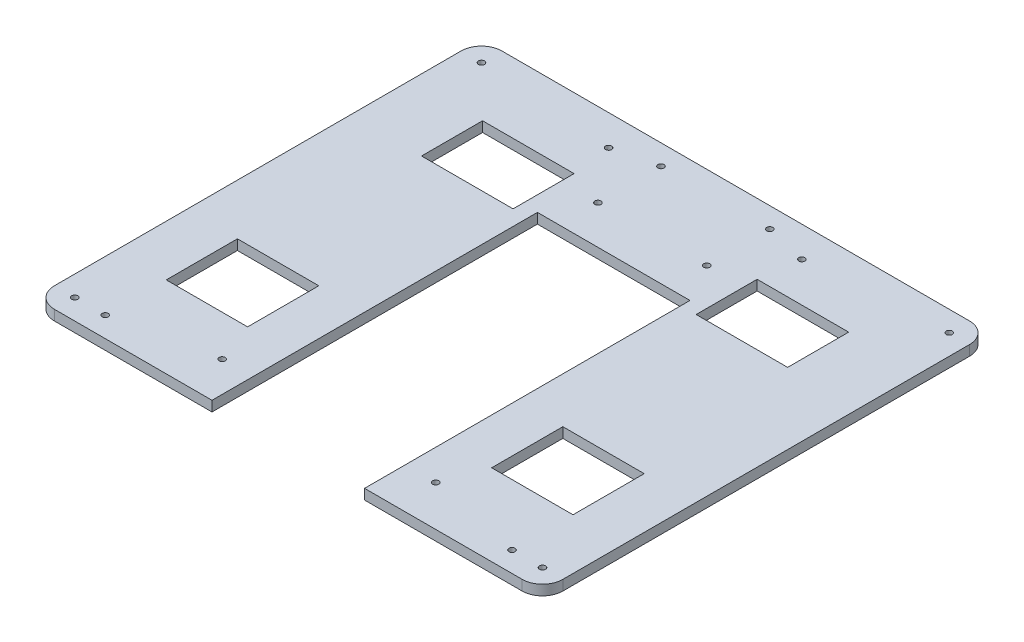
from build123d import *

# Parameters (mm, degrees)
EXTRUDE_1_DEPTH      = 5
SKETCH_4_W           = 45
SKETCH_4_H           = 30
CUT_EXTRUDE_3_DEPTH  = 5
SKETCH_5_W           = 75
SKETCH_5_H           = 160
CUT_EXTRUDE_4_DEPTH  = 5
CUT_EXTRUDE_5_REACH  = 335.054
SKETCH_6_R           = 1.5
CUT_EXTRUDE_9_REACH  = 335.054
SKETCH_9_R           = 1.5
SKETCH_11_R          = 1.5
CUT_EXTRUDE_10_DEPTH = 10
SKETCH_12_R          = 1.5
CUT_EXTRUDE_11_DEPTH = 10
SKETCH_13_R          = 1.5
CUT_EXTRUDE_12_DEPTH = 10
SKETCH_14_W          = 40
SKETCH_14_H          = 35
CUT_EXTRUDE_13_DEPTH = 10


with BuildPart() as part:
    # 草图1 → 凸台-拉伸1 (new body)
    with BuildSketch(Plane(origin=(0, 0, 0), x_dir=(1, 0, 0), z_dir=(0, 1, 0))):
        with BuildLine():
            Line((10, 0), (240, 0))
            ThreePointArc((240, 0), (247.071067812, -2.928932188), (250, -10))
            Line((250, -10), (250, -210))
            ThreePointArc((250, -210), (247.071067812, -217.071067812), (240, -220))
            Line((240, -220), (10, -220))
            ThreePointArc((10, -220), (2.928932188, -217.071067812), (0, -210))
            Line((0, -210), (0, -10))
            ThreePointArc((0, -10), (2.928932188, -2.928932188), (10, 0))
        make_face()
    extrude(amount=EXTRUDE_1_DEPTH)

    # 草图4 → 切除-拉伸3 (cut)
    with BuildSketch(Plane.XZ):
        with Locations((192.5, 49.475)):
            Rectangle(SKETCH_4_W, SKETCH_4_H)
        with Locations((57.5, 49.475)):
            Rectangle(SKETCH_4_W, SKETCH_4_H)
    extrude(amount=-CUT_EXTRUDE_3_DEPTH, mode=Mode.SUBTRACT)

    # 草图5 → 切除-拉伸4 (cut)
    with BuildSketch(Plane.XZ):
        with Locations((125, 140)):
            Rectangle(SKETCH_5_W, SKETCH_5_H)
    extrude(amount=-CUT_EXTRUDE_4_DEPTH, mode=Mode.SUBTRACT)

    # 草图6 → 切除-拉伸5 (cut, up to next)
    with BuildSketch(Plane.XZ, mode=Mode.PRIVATE) as cut_extrude_5_sk1:
        with Locations((72.5, 200)):
            Circle(SKETCH_6_R)
    cut_extrude_5_tool1 = extrude(cut_extrude_5_sk1.sketch, amount=-CUT_EXTRUDE_5_REACH, mode=Mode.PRIVATE) & part.part
    # 草图6 → 切除-拉伸5 (cut, up to next)
    with BuildSketch(Plane.XZ, mode=Mode.PRIVATE) as cut_extrude_5_sk2:
        with Locations((177.5, 200)):
            Circle(SKETCH_6_R)
    cut_extrude_5_tool2 = extrude(cut_extrude_5_sk2.sketch, amount=-CUT_EXTRUDE_5_REACH, mode=Mode.PRIVATE) & part.part
    add(cut_extrude_5_tool1.solids().sort_by_distance((72.5, 0, 200))[0], mode=Mode.SUBTRACT)
    add(cut_extrude_5_tool2.solids().sort_by_distance((177.5, 0, 200))[0], mode=Mode.SUBTRACT)

    # 草图9 → 切除-拉伸9 (cut, up to next)
    with BuildSketch(Plane.XZ, mode=Mode.PRIVATE) as cut_extrude_9_sk1:
        with Locations((77.5, 15)):
            Circle(SKETCH_9_R)
    cut_extrude_9_tool1 = extrude(cut_extrude_9_sk1.sketch, amount=-CUT_EXTRUDE_9_REACH, mode=Mode.PRIVATE) & part.part
    # 草图9 → 切除-拉伸9 (cut, up to next)
    with BuildSketch(Plane.XZ, mode=Mode.PRIVATE) as cut_extrude_9_sk2:
        with Locations((10, 210)):
            Circle(SKETCH_9_R)
    cut_extrude_9_tool2 = extrude(cut_extrude_9_sk2.sketch, amount=-CUT_EXTRUDE_9_REACH, mode=Mode.PRIVATE) & part.part
    # 草图9 → 切除-拉伸9 (cut, up to next)
    with BuildSketch(Plane.XZ, mode=Mode.PRIVATE) as cut_extrude_9_sk3:
        with Locations((240, 210)):
            Circle(SKETCH_9_R)
    cut_extrude_9_tool3 = extrude(cut_extrude_9_sk3.sketch, amount=-CUT_EXTRUDE_9_REACH, mode=Mode.PRIVATE) & part.part
    # 草图9 → 切除-拉伸9 (cut, up to next)
    with BuildSketch(Plane.XZ, mode=Mode.PRIVATE) as cut_extrude_9_sk4:
        with Locations((172.5, 15)):
            Circle(SKETCH_9_R)
    cut_extrude_9_tool4 = extrude(cut_extrude_9_sk4.sketch, amount=-CUT_EXTRUDE_9_REACH, mode=Mode.PRIVATE) & part.part
    add(cut_extrude_9_tool1.solids().sort_by_distance((77.5, 0, 15))[0], mode=Mode.SUBTRACT)
    add(cut_extrude_9_tool2.solids().sort_by_distance((10, 0, 210))[0], mode=Mode.SUBTRACT)
    add(cut_extrude_9_tool3.solids().sort_by_distance((240, 0, 210))[0], mode=Mode.SUBTRACT)
    add(cut_extrude_9_tool4.solids().sort_by_distance((172.5, 0, 15))[0], mode=Mode.SUBTRACT)

    # 草图11 → 切除-拉伸10 (cut)
    with BuildSketch(Plane.XZ):
        with Locations((25, 210)):
            Circle(SKETCH_11_R)
        with Locations((225, 210)):
            Circle(SKETCH_11_R)
    extrude(amount=-CUT_EXTRUDE_10_DEPTH, mode=Mode.SUBTRACT)

    # 草图12 → 切除-拉伸11 (cut)
    with BuildSketch(Plane.XZ):
        with Locations((10, 10)):
            Circle(SKETCH_12_R)
        with Locations((240, 10)):
            Circle(SKETCH_12_R)
    extrude(amount=-CUT_EXTRUDE_11_DEPTH, mode=Mode.SUBTRACT)

    # 草图13 → 切除-拉伸12 (cut)
    with BuildSketch(Plane.XZ):
        with Locations((98.25, 10)):
            Circle(SKETCH_13_R)
        with Locations((98.25, 41)):
            Circle(SKETCH_13_R)
        with Locations((151.75, 41)):
            Circle(SKETCH_13_R)
        with Locations((151.75, 10)):
            Circle(SKETCH_13_R)
    extrude(amount=-CUT_EXTRUDE_12_DEPTH, mode=Mode.SUBTRACT)

    # 草图14 → 切除-拉伸13 (cut)
    with BuildSketch(Plane.XZ):
        with Locations((45, 162.5)):
            Rectangle(SKETCH_14_W, SKETCH_14_H)
        with Locations((205, 162.5)):
            Rectangle(SKETCH_14_W, SKETCH_14_H)
    extrude(amount=-CUT_EXTRUDE_13_DEPTH, mode=Mode.SUBTRACT)


solid = part.part
